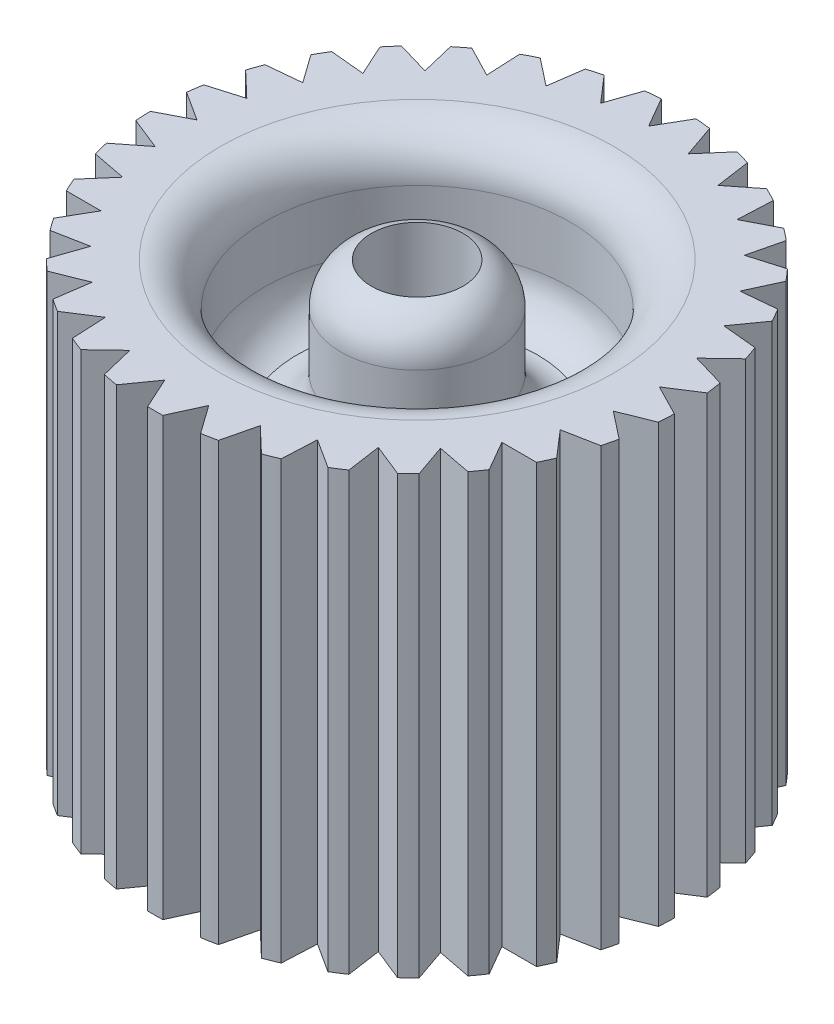
from build123d import *

# Parameters (mm, degrees)
SKETCH1_R           = 15.24
BOSS_EXTRUDE1_DEPTH = 25.4
SKETCH2_R           = 2.667
CUT_EXTRUDE1_DEPTH  = 6.35
CUT_EXTRUDE2_START  = -25.4
CUT_EXTRUDE2_DEPTH  = 25.4
SKETCH4_R           = 8.89
CUT_EXTRUDE3_DEPTH  = 12.7
CUT_EXTRUDE7_START  = -25.4
SKETCH5_R           = 8.89
SKETCH5_R_2         = 4.445
CUT_EXTRUDE7_DEPTH  = 25.4
SKETCH6_R           = 2.667
CUT_EXTRUDE8_DEPTH  = 25.4
SKETCH7_R           = 4.445
SKETCH7_R_2         = 2.667
BOSS_EXTRUDE3_DEPTH = 12.7
SKETCH8_W           = 9.289209113
SKETCH8_H           = 8.847359644
SKETCH9_R           = 2.667
CUT_EXTRUDE9_DEPTH  = 12.7
FILLET1_R           = 2.54
FILLET2_R           = 2.54
FILLET3_R           = 2.54


with BuildPart() as part:
    # Sketch1 → Boss-Extrude1 (new body)
    with BuildSketch(Plane(origin=(0, 0, 0), x_dir=(1, 0, 0), z_dir=(0, 1, 0))):
        with Locations(Location((0, 0, 0), (0, 0, 270))):
            Circle(SKETCH1_R)
    extrude(amount=BOSS_EXTRUDE1_DEPTH)

    # Sketch2 → Cut-Extrude1 (cut)
    with BuildSketch(Plane(origin=(0, 0, 0), x_dir=(-1, 0, 0), z_dir=(0, -1, 0))):
        with Locations(Location((0, 0, 0), (0, 0, 90))):
            Circle(SKETCH2_R)
    extrude(amount=-CUT_EXTRUDE1_DEPTH, mode=Mode.SUBTRACT)

    # Cut-Extrude2: read off the stored shape, not the designer's step
    # Cut-Extrude2 outline → Cut-Extrude2 (cut)
    with BuildSketch(Plane(origin=(0, 25.4, 0), x_dir=(1, 0, 0), z_dir=(0, 1, 0)).offset(CUT_EXTRUDE2_START)):
        with BuildLine():
            ThreePointArc((1.007288675, 15.206675163), (0, 15.24), (-1.007288675, 15.206675163))
            Line((-1.007288675, 15.206675163), (0, 13.462))
            Line((0, 13.462), (1.007288675, 15.206675163))
        make_face()
        with BuildLine():
            Line((-2.547700252, 13.218724123), (-1.888796541, 15.122501368))
            ThreePointArc((-1.888796541, 15.122501368), (-2.884188964, 14.964593346), (-3.866967854, 14.741240098))
            Line((-3.866967854, 14.741240098), (-2.547700252, 13.218724123))
        make_face()
        with BuildLine():
            ThreePointArc((3.866967854, 14.741240098), (2.884188964, 14.964593346), (1.888796541, 15.122501368))
            Line((1.888796541, 15.122501368), (2.547700252, 13.218724123))
            Line((2.547700252, 13.218724123), (3.866967854, 14.741240098))
        make_face()
        with BuildLine():
            Line((-5.003319978, 12.497689114), (-4.716615728, 14.491760972))
            ThreePointArc((-4.716615728, 14.491760972), (-5.664135824, 14.148327299), (-6.586884739, 13.743018207))
            Line((-6.586884739, 13.743018207), (-5.003319978, 12.497689114))
        make_face()
        with BuildLine():
            ThreePointArc((6.586884739, 13.743018207), (5.664135824, 14.148327299), (4.716615728, 14.491760972))
            Line((4.716615728, 14.491760972), (5.003319978, 12.497689114))
            Line((5.003319978, 12.497689114), (6.586884739, 13.743018207))
        make_face()
        with BuildLine():
            Line((-7.278106685, 11.324955059), (-7.373964134, 13.337250577))
            ThreePointArc((-7.373964134, 13.337250577), (-8.239366058, 12.82070384), (-9.068734448, 12.248087831))
            Line((-9.068734448, 12.248087831), (-7.278106685, 11.324955059))
        make_face()
        with BuildLine():
            ThreePointArc((9.068734448, 12.248087831), (8.239366058, 12.82070384), (7.373964134, 13.337250577))
            Line((7.373964134, 13.337250577), (7.278106685, 11.324955059))
            Line((7.278106685, 11.324955059), (9.068734448, 12.248087831))
        make_face()
        with BuildLine():
            Line((-9.289843653, 9.742907621), (-9.764798264, 11.700697195))
            ThreePointArc((-9.764798264, 11.700697195), (-10.516804135, 11.029706741), (-11.222816465, 10.310479649))
            Line((-11.222816465, 10.310479649), (-9.289843653, 9.742907621))
        make_face()
        with BuildLine():
            ThreePointArc((11.222816465, 10.310479649), (10.516804135, 11.029706741), (9.764798264, 11.700697195))
            Line((9.764798264, 11.700697195), (9.289843653, 9.742907621))
            Line((9.289843653, 9.742907621), (11.222816465, 10.310479649))
        make_face()
        with BuildLine():
            Line((-10.965821466, 7.808726117), (-11.802707143, 9.641250132))
            ThreePointArc((-11.802707143, 9.641250132), (-12.414137509, 8.840067302), (-12.971276655, 8.000223869))
            Line((-12.971276655, 8.000223869), (-10.965821466, 7.808726117))
        make_face()
        with BuildLine():
            ThreePointArc((12.971276655, 8.000223869), (12.414137509, 8.840067302), (11.802707143, 9.641250132))
            Line((11.802707143, 9.641250132), (10.965821467, 7.808726117))
            Line((10.965821467, 7.808726117), (12.971276655, 8.000223869))
        make_face()
        with BuildLine():
            Line((-12.245465921, 5.592316905), (-13.414035433, 7.233343168))
            ThreePointArc((-13.414035433, 7.233343168), (-13.862791609, 6.330924798), (-14.25092111, 5.400819153))
            Line((-14.25092111, 5.400819153), (-12.245465921, 5.592316905))
        make_face()
        with BuildLine():
            ThreePointArc((14.25092111, 5.400819153), (13.862791609, 6.330924798), (13.414035433, 7.233343168))
            Line((13.414035433, 7.233343168), (12.245465921, 5.592316905))
            Line((12.245465921, 5.592316905), (14.25092111, 5.400819153))
        make_face()
        with BuildLine():
            Line((-13.082527333, 3.17378679), (-14.540545534, 4.564004336))
            ThreePointArc((-14.540545534, 4.564004336), (-14.810408301, 3.592966177), (-15.015500145, 2.606214762))
            Line((-15.015500145, 2.606214762), (-13.082527333, 3.17378679))
        make_face()
        with BuildLine():
            ThreePointArc((15.015500145, 2.606214762), (14.810408301, 3.592966177), (14.540545534, 4.564004336))
            Line((14.540545534, 4.564004336), (13.082527333, 3.17378679))
            Line((13.082527333, 3.17378679), (15.015500145, 2.606214762))
        make_face()
        with BuildLine():
            Line((-13.44675212, 0.640547751), (-15.141522433, 1.729710496))
            ThreePointArc((-15.141522433, 1.729710496), (-15.222738249, 0.725148397), (-15.237379883, -0.282585021))
            Line((-15.237379883, -0.282585021), (-13.44675212, 0.640547751))
        make_face()
        with BuildLine():
            ThreePointArc((15.237379883, -0.282585021), (15.222738249, 0.725148397), (15.141522433, 1.729710496))
            Line((15.141522433, 1.729710496), (13.44675212, 0.640547751))
            Line((13.44675212, 0.640547751), (15.237379883, -0.282585021))
        make_face()
        with BuildLine():
            Line((-13.324976251, -1.915842353), (-15.195245261, -1.167099588))
            ThreePointArc((-15.195245261, -1.167099588), (-15.084878774, -2.168878135), (-14.908541012, -3.161171445))
            Line((-14.908541012, -3.161171445), (-13.324976251, -1.915842353))
        make_face()
        with BuildLine():
            ThreePointArc((14.908541012, -3.161171445), (15.084878774, -2.168878135), (15.195245261, -1.167099588))
            Line((15.195245261, -1.167099588), (13.324976251, -1.915842353))
            Line((13.324976251, -1.915842353), (14.908541012, -3.161171445))
        make_face()
        with BuildLine():
            Line((-12.721601022, -4.402988922), (-14.699772335, -4.021727652))
            ThreePointArc((-14.699772335, -4.021727652), (-14.401812477, -4.984515761), (-14.040868624, -5.925504897))
            Line((-14.040868624, -5.925504897), (-12.721601022, -4.402988922))
        make_face()
        with BuildLine():
            ThreePointArc((14.040868624, -5.925504897), (14.401812477, -4.984515761), (14.699772335, -4.021727652))
            Line((14.699772335, -4.021727652), (12.721601022, -4.402988922))
            Line((12.721601022, -4.402988922), (14.040868624, -5.925504897))
        make_face()
        with BuildLine():
            Line((-11.658433986, -6.731), (-13.673011336, -6.731))
            ThreePointArc((-13.673011336, -6.731), (-13.198227154, -7.62), (-12.665722661, -8.475675163))
            Line((-12.665722661, -8.475675163), (-11.658433986, -6.731))
        make_face()
        with BuildLine():
            ThreePointArc((12.665722661, -8.475675163), (13.198227154, -7.62), (13.673011336, -6.731))
            Line((13.673011336, -6.731), (11.658433986, -6.731))
            Line((11.658433986, -6.731), (12.665722661, -8.475675163))
        make_face()
        with BuildLine():
            Line((-10.17390077, -8.8157352), (-12.152072083, -9.196996471))
            ThreePointArc((-12.152072083, -9.196996471), (-11.517623513, -9.980077585), (-10.832804481, -10.719512446))
            Line((-10.832804481, -10.719512446), (-10.17390077, -8.8157352))
        make_face()
        with BuildLine():
            ThreePointArc((10.832804481, -10.719512446), (11.517623513, -9.980077585), (12.152072083, -9.196996471))
            Line((12.152072083, -9.196996471), (10.17390077, -8.8157352))
            Line((10.17390077, -8.8157352), (10.832804481, -10.719512446))
        make_face()
        with BuildLine():
            Line((-8.321656272, -10.581846761), (-10.191925283, -11.330589527))
            ThreePointArc((-10.191925283, -11.330589527), (-9.42074295, -11.979449164), (-8.608360522, -12.575918619))
            Line((-8.608360522, -12.575918619), (-8.321656272, -10.581846761))
        make_face()
        with BuildLine():
            ThreePointArc((8.608360522, -12.575918619), (9.42074295, -11.979449164), (10.191925283, -11.330589527))
            Line((10.191925283, -11.330589527), (8.321656273, -10.581846761))
            Line((8.321656273, -10.581846761), (8.608360522, -12.575918619))
        make_face()
        with BuildLine():
            Line((-6.168645435, -11.96550281), (-7.863415749, -13.054665555))
            ThreePointArc((-7.863415749, -13.054665555), (-6.983372192, -13.545852237), (-6.072787986, -13.977798327))
            Line((-6.072787986, -13.977798327), (-6.168645435, -11.96550281))
        make_face()
        with BuildLine():
            ThreePointArc((6.072787986, -13.977798327), (6.983372192, -13.545852237), (7.863415749, -13.054665555))
            Line((7.863415749, -13.054665555), (6.168645436, -11.96550281))
            Line((6.168645436, -11.96550281), (6.072787986, -13.977798327))
        make_face()
        with BuildLine():
            Line((-3.79268368, -12.916694411), (-5.250701881, -14.306911957))
            ThreePointArc((-5.250701881, -14.306911957), (-4.293604167, -14.622672918), (-3.317729069, -14.874483985))
            Line((-3.317729069, -14.874483985), (-3.79268368, -12.916694411))
        make_face()
        with BuildLine():
            ThreePointArc((3.317729069, -14.874483985), (4.293604167, -14.622672918), (5.250701881, -14.306911957))
            Line((5.250701881, -14.306911957), (3.79268368, -12.916694411))
            Line((3.79268368, -12.916694411), (3.317729069, -14.874483985))
        make_face()
        with BuildLine():
            Line((-1.279644455, -13.401043022), (-2.448213967, -15.042069285))
            ThreePointArc((-2.448213967, -15.042069285), (-1.4486541, -15.1709921), (-0.442758779, -15.233567037))
            Line((-0.442758779, -15.233567037), (-1.279644455, -13.401043022))
        make_face()
        with BuildLine():
            ThreePointArc((0.442758779, -15.233567037), (1.4486541, -15.1709921), (2.448213967, -15.042069285))
            Line((2.448213967, -15.042069285), (1.279644455, -13.401043022))
            Line((1.279644455, -13.401043022), (0.442758779, -15.233567037))
        make_face()
    extrude(amount=CUT_EXTRUDE2_DEPTH, mode=Mode.SUBTRACT)

    # Sketch4 → Cut-Extrude3 (cut)
    with BuildSketch(Plane(origin=(0, 25.4, 0), x_dir=(1, 0, 0), z_dir=(0, 1, 0))):
        with Locations(Location((0, 0, 0), (0, 0, 270))):
            Circle(SKETCH4_R)
    extrude(amount=-CUT_EXTRUDE3_DEPTH, mode=Mode.SUBTRACT)

    # Sketch5 → Cut-Extrude7 (cut)
    with BuildSketch(Plane(origin=(0, 0, 0), x_dir=(-1, 0, 0), z_dir=(0, -1, 0)).offset(CUT_EXTRUDE7_START)):
        with Locations(Location((0, 0, 0), (0, 0, 270))):
            Circle(SKETCH5_R)
        with Locations(Location((0, 0, 0), (0, 0, 90))):
            Circle(SKETCH5_R_2, mode=Mode.SUBTRACT)
    extrude(amount=CUT_EXTRUDE7_DEPTH, mode=Mode.SUBTRACT)


with BuildPart() as cut_extrude7_piece_1:
    # of the separate pieces the step leaves, piece 1, a body of its own (cut_extrude7_pieces)
    add(part.part.solids().sort_by_distance((-0.442758779, 0, 15.233567037))[0])



with BuildPart() as cut_extrude7_piece_2:
    # of the separate pieces the step leaves, piece 2, a body of its own (cut_extrude7_pieces)
    add(part.part.solids().sort_by_distance((0, 0, -4.445))[0])

    # Sketch6 → Cut-Extrude8 (cut)
    with BuildSketch(Plane(origin=(0, 6.35, 0), x_dir=(-1, 0, 0), z_dir=(0, -1, 0))):
        with Locations(Location((0, 0, 0), (0, 0, 90))):
            Circle(SKETCH6_R)
    extrude(amount=-CUT_EXTRUDE8_DEPTH, mode=Mode.SUBTRACT)

    # Sketch7 → Boss-Extrude3 (add)
    with BuildSketch(Plane(origin=(0, 12.7, 0), x_dir=(1, 0, 0), z_dir=(0, 1, 0))):
        with Locations(Location((0, 0, 0), (0, 0, 90))):
            Circle(SKETCH7_R)
        with Locations(Location((0, 0, 0), (0, 0, 90))):
            Circle(SKETCH7_R_2, mode=Mode.SUBTRACT)
    extrude(amount=BOSS_EXTRUDE3_DEPTH)


with BuildPart() as cut_extrude7_piece_1_1:
    add(cut_extrude7_piece_1.part)

    add(cut_extrude7_piece_2.part)  # Revolve2 merges Cut-Extrude7 piece 2
    # Sketch8 → Revolve2 (revolve)
    with BuildSketch(Plane(origin=(0, 0, 0), x_dir=(0, 0, -1), z_dir=(1, 0, 0))):
        with Locations((4.644604557, 12.7)):
            Rectangle(SKETCH8_W, SKETCH8_H)
    revolve(axis=Axis((0, 17.123679822, 0), (0, -1, 0)))

    # Sketch9 → Cut-Extrude9 (cut)
    with BuildSketch(Plane(origin=(0, 17.123679822, 0), x_dir=(1, 0, 0), z_dir=(0, 1, 0))):
        with Locations(Location((0, 0, 0), (0, 0, 90))):
            Circle(SKETCH9_R)
    extrude(amount=-CUT_EXTRUDE9_DEPTH, mode=Mode.SUBTRACT)

    # Fillet1
    fillet1_edges = [cut_extrude7_piece_1_1.edges().sort_by_distance(p)[0] for p in [
        (0, 25.4, -8.89),
        (0, 0, -8.89),
        (0, 17.123679822, 4.445),
        (0, 8.276320178, 4.445),
    ]]
    fillet(fillet1_edges, radius=FILLET1_R)

    # Fillet2
    # the kernel refuses this fillet: 2.54 mm, written as the material it adds along each edge
    with BuildSketch(Plane(origin=(0, 17.123679822, 0), x_dir=(0, 0, 1), z_dir=(-1, 0, 0))) as fillet2_piece_1:
        with BuildLine():
            CenterArc((6.35, 2.459344425), FILLET2_R, 284.477512186, 75.522487814)
            Line((8.89, 2.459344425), (8.9408, 2.459344425))
            Line((8.9408, 2.459344425), (8.9408, 0))
            Line((8.9408, 0), (8.89, -0.0508))
            ThreePointArc((8.89, -0.0508), (7.9375, -0.0508), (6.9977, -0.049186888))
            Line((6.9977, -0.049186888), (6.985, 0))
        make_face()
    revolve(axis=Axis((0, 17.123679822, 0), (0, 1, 0)))
    with BuildSketch(Plane(origin=(0, 8.276320178, 0), x_dir=(0, 0, 1), z_dir=(-1, 0, 0))) as fillet2_piece_2:
        with BuildLine():
            CenterArc((6.35, -2.459344425), FILLET2_R, 0, 75.522487814)
            Line((8.89, -2.459344425), (8.9408, -2.459344425))
            Line((8.9408, -2.459344425), (8.9408, 0))
            Line((8.9408, 0), (8.89, 0.0508))
            ThreePointArc((8.89, 0.0508), (7.9375, 0.0508), (6.9977, 0.049186888))
            Line((6.9977, 0.049186888), (6.985, 0))
        make_face()
    revolve(axis=Axis((0, 8.276320178, 0), (0, 1, 0)))

    # Fillet3
    # the kernel refuses this fillet: 2.54 mm, written as the material it takes off along each edge
    with BuildSketch(Plane(origin=(0, 0, 0), x_dir=(0, 0, -1), z_dir=(-1, 0, 0))) as fillet3_piece_1:
        with BuildLine():
            CenterArc((1.905, -2.423005572), FILLET3_R, 0, 72.542396876)
            Line((2.667, 0), (2.68224, 0.048460111))
            ThreePointArc((2.68224, 0.048460111), (3.556, 0.0508), (4.445, 0.0508))
            Line((4.445, 0.0508), (4.4958, 0))
            Line((4.4958, 0), (4.4958, -2.423005572))
            Line((4.4958, -2.423005572), (4.445, -2.423005572))
        make_face()
    revolve(axis=Axis((0, 0, 0), (0, -1, 0)), mode=Mode.SUBTRACT)
    with BuildSketch(Plane(origin=(0, 25.4, 0), x_dir=(0, 0, -1), z_dir=(1, 0, 0))) as fillet3_piece_2:
        with BuildLine():
            CenterArc((1.905, -2.423005572), FILLET3_R, 0, 72.542396876)
            Line((4.445, -2.423005572), (4.4958, -2.423005572))
            Line((4.4958, -2.423005572), (4.4958, 0))
            Line((4.4958, 0), (4.445, 0.0508))
            ThreePointArc((4.445, 0.0508), (3.556, 0.0508), (2.68224, 0.048460111))
            Line((2.68224, 0.048460111), (2.667, 0))
        make_face()
    revolve(axis=Axis((0, 25.4, 0), (0, 1, 0)), mode=Mode.SUBTRACT)


solid = cut_extrude7_piece_1_1.part
